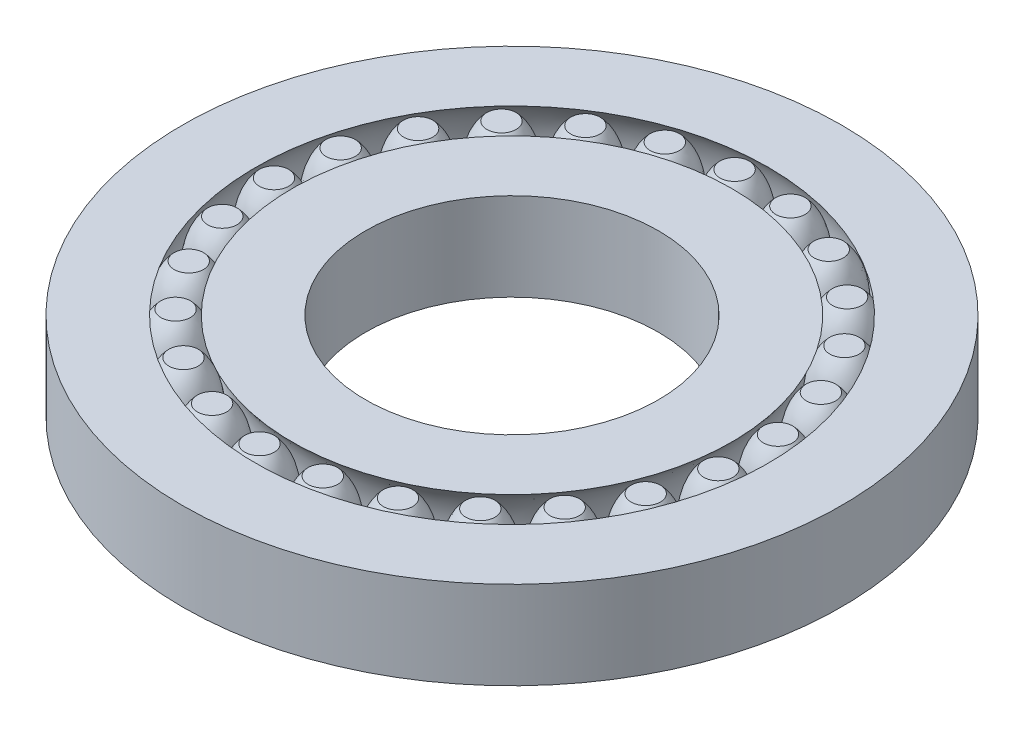
from build123d import *

# Parameters (mm, degrees)
CIRPATTERN7_COUNT = 25


with BuildPart() as part:
    # Sketch1 → Revolve1 (revolve)
    with BuildSketch(Plane.XY):
        with BuildLine():
            Line((-10, 3), (-15, 3))
            add(Edge.make_bspline(
                [(-15, -3), (-12.2, 0), (-15, 3)],
                knots=[3.730623624, 3.730623624, 3.730623624, 5.694154337, 5.694154337, 5.694154337], degree=2, weights=[1, 0.555555556, 1]))
            Line((-15, -3), (-10, -3))
            Line((-10, -3), (-10, 3))
        make_face()
        with BuildLine():
            Line((-22.5, -3), (-17.5, -3))
            add(Edge.make_bspline(
                [(-17.5, 3), (-20.3, 0), (-17.5, -3)],
                knots=[0.58903097, 0.58903097, 0.58903097, 2.552561683, 2.552561683, 2.552561683], degree=2, weights=[1, 0.555555556, 1]))
            Line((-17.5, 3), (-22.5, 3))
            Line((-22.5, 3), (-22.5, -3))
        make_face()
    revolve(axis=Axis((0, 0, 0), (0, 1, 0)))


with BuildPart() as body_2:
    # Sketch3 → Revolve2 (revolve)
    with BuildSketch(Plane.XY):
        with BuildLine():
            Line((-15.25, 3), (-16.25, 3))
            Line((-16.25, 3), (-16.25, -3))
            Line((-16.25, -3), (-15.25, -3))
            add(Edge.make_bspline(
                [(-15.25, -3), (-12.25, 0), (-15.25, 3)],
                knots=[3.665191429, 3.665191429, 3.665191429, 5.759586532, 5.759586532, 5.759586532], degree=2, weights=[1, 0.5, 1]))
        make_face()
    revolve(axis=Axis((-16.25, -3, 0), (0, 1, 0)))


with BuildPart() as cirpattern7_1:
    # CirPattern7: pattern copy
    add(body_2.part.rotate(Axis((0, 3, 0), (0, -1, 0)), 1 * 360 / CIRPATTERN7_COUNT))


with BuildPart() as cirpattern7_2:
    # CirPattern7: pattern copy
    add(body_2.part.rotate(Axis((0, 3, 0), (0, -1, 0)), 2 * 360 / CIRPATTERN7_COUNT))


with BuildPart() as cirpattern7_3:
    # CirPattern7: pattern copy
    add(body_2.part.rotate(Axis((0, 3, 0), (0, -1, 0)), 3 * 360 / CIRPATTERN7_COUNT))


with BuildPart() as cirpattern7_4:
    # CirPattern7: pattern copy
    add(body_2.part.rotate(Axis((0, 3, 0), (0, -1, 0)), 4 * 360 / CIRPATTERN7_COUNT))


with BuildPart() as cirpattern7_5:
    # CirPattern7: pattern copy
    add(body_2.part.rotate(Axis((0, 3, 0), (0, -1, 0)), 5 * 360 / CIRPATTERN7_COUNT))


with BuildPart() as cirpattern7_6:
    # CirPattern7: pattern copy
    add(body_2.part.rotate(Axis((0, 3, 0), (0, -1, 0)), 6 * 360 / CIRPATTERN7_COUNT))


with BuildPart() as cirpattern7_7:
    # CirPattern7: pattern copy
    add(body_2.part.rotate(Axis((0, 3, 0), (0, -1, 0)), 7 * 360 / CIRPATTERN7_COUNT))


with BuildPart() as cirpattern7_8:
    # CirPattern7: pattern copy
    add(body_2.part.rotate(Axis((0, 3, 0), (0, -1, 0)), 8 * 360 / CIRPATTERN7_COUNT))


with BuildPart() as cirpattern7_9:
    # CirPattern7: pattern copy
    add(body_2.part.rotate(Axis((0, 3, 0), (0, -1, 0)), 9 * 360 / CIRPATTERN7_COUNT))


with BuildPart() as cirpattern7_10:
    # CirPattern7: pattern copy
    add(body_2.part.rotate(Axis((0, 3, 0), (0, -1, 0)), 10 * 360 / CIRPATTERN7_COUNT))


with BuildPart() as cirpattern7_11:
    # CirPattern7: pattern copy
    add(body_2.part.rotate(Axis((0, 3, 0), (0, -1, 0)), 11 * 360 / CIRPATTERN7_COUNT))


with BuildPart() as cirpattern7_12:
    # CirPattern7: pattern copy
    add(body_2.part.rotate(Axis((0, 3, 0), (0, -1, 0)), 12 * 360 / CIRPATTERN7_COUNT))


with BuildPart() as cirpattern7_13:
    # CirPattern7: pattern copy
    add(body_2.part.rotate(Axis((0, 3, 0), (0, -1, 0)), 13 * 360 / CIRPATTERN7_COUNT))


with BuildPart() as cirpattern7_14:
    # CirPattern7: pattern copy
    add(body_2.part.rotate(Axis((0, 3, 0), (0, -1, 0)), 14 * 360 / CIRPATTERN7_COUNT))


with BuildPart() as cirpattern7_15:
    # CirPattern7: pattern copy
    add(body_2.part.rotate(Axis((0, 3, 0), (0, -1, 0)), 15 * 360 / CIRPATTERN7_COUNT))


with BuildPart() as cirpattern7_16:
    # CirPattern7: pattern copy
    add(body_2.part.rotate(Axis((0, 3, 0), (0, -1, 0)), 16 * 360 / CIRPATTERN7_COUNT))


with BuildPart() as cirpattern7_17:
    # CirPattern7: pattern copy
    add(body_2.part.rotate(Axis((0, 3, 0), (0, -1, 0)), 17 * 360 / CIRPATTERN7_COUNT))


with BuildPart() as cirpattern7_18:
    # CirPattern7: pattern copy
    add(body_2.part.rotate(Axis((0, 3, 0), (0, -1, 0)), 18 * 360 / CIRPATTERN7_COUNT))


with BuildPart() as cirpattern7_19:
    # CirPattern7: pattern copy
    add(body_2.part.rotate(Axis((0, 3, 0), (0, -1, 0)), 19 * 360 / CIRPATTERN7_COUNT))


with BuildPart() as cirpattern7_20:
    # CirPattern7: pattern copy
    add(body_2.part.rotate(Axis((0, 3, 0), (0, -1, 0)), 20 * 360 / CIRPATTERN7_COUNT))


with BuildPart() as cirpattern7_21:
    # CirPattern7: pattern copy
    add(body_2.part.rotate(Axis((0, 3, 0), (0, -1, 0)), 21 * 360 / CIRPATTERN7_COUNT))


with BuildPart() as cirpattern7_22:
    # CirPattern7: pattern copy
    add(body_2.part.rotate(Axis((0, 3, 0), (0, -1, 0)), 22 * 360 / CIRPATTERN7_COUNT))


with BuildPart() as cirpattern7_23:
    # CirPattern7: pattern copy
    add(body_2.part.rotate(Axis((0, 3, 0), (0, -1, 0)), 23 * 360 / CIRPATTERN7_COUNT))


with BuildPart() as cirpattern7_24:
    # CirPattern7: pattern copy
    add(body_2.part.rotate(Axis((0, 3, 0), (0, -1, 0)), 24 * 360 / CIRPATTERN7_COUNT))


solid = Compound([part.part, body_2.part, cirpattern7_1.part, cirpattern7_2.part, cirpattern7_3.part, cirpattern7_4.part, cirpattern7_5.part, cirpattern7_6.part, cirpattern7_7.part, cirpattern7_8.part, cirpattern7_9.part, cirpattern7_10.part, cirpattern7_11.part, cirpattern7_12.part, cirpattern7_13.part, cirpattern7_14.part, cirpattern7_15.part, cirpattern7_16.part, cirpattern7_17.part, cirpattern7_18.part, cirpattern7_19.part, cirpattern7_20.part, cirpattern7_21.part, cirpattern7_22.part, cirpattern7_23.part, cirpattern7_24.part])
